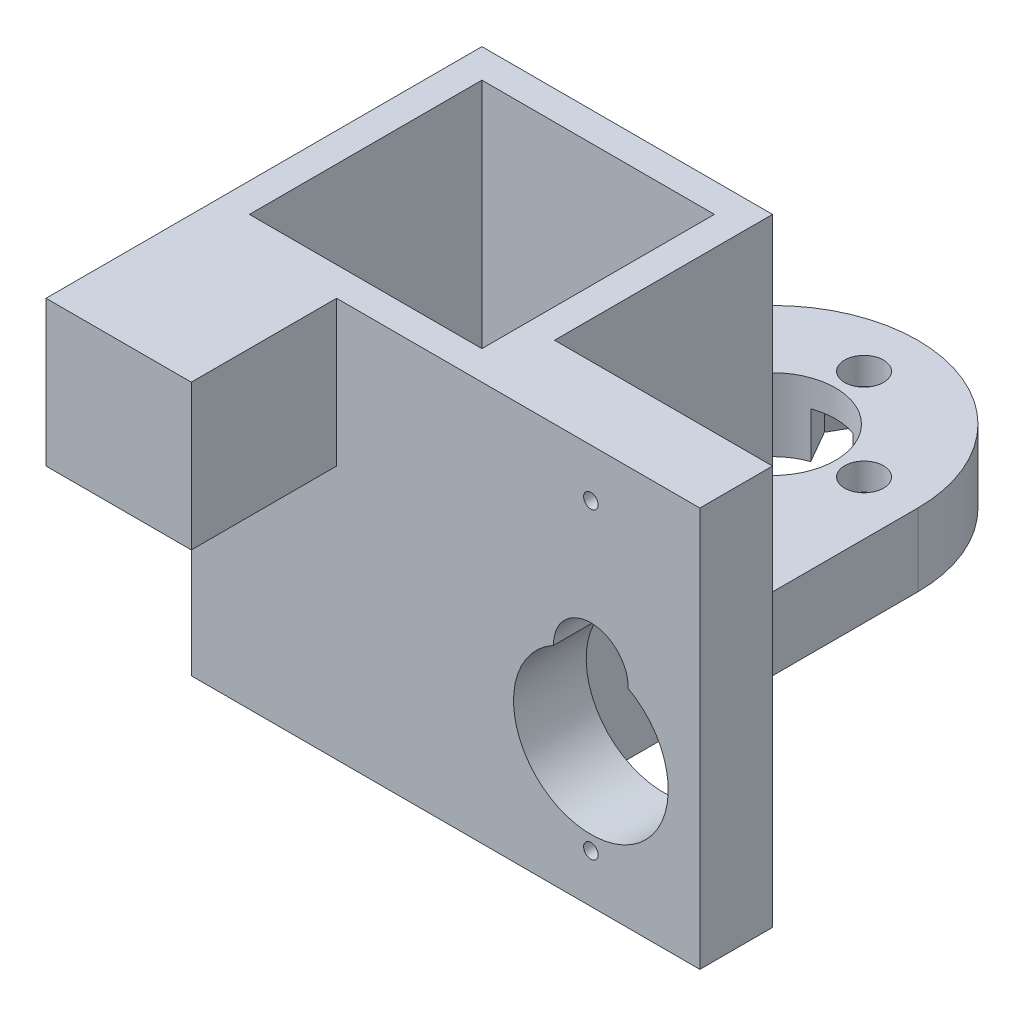
from build123d import *

# Parameters (mm, degrees)
SKETCH1_W            = 25.4
SKETCH1_H            = 25.4
SKETCH1_W_2          = 20.32
SKETCH1_H_2          = 20.32
BOSS_EXTRUDE1_DEPTH  = 17.4625
SKETCH4_W            = 25.4
SKETCH4_H            = 25.4
BOSS_EXTRUDE2_DEPTH  = 6.35
CUT_EXTRUDE1_REACH   = 51.289
SKETCH6_R            = 5.5
FILLET1_R            = 12.7
M3_CLEARANCE_HOLE1_D = 3.4
CIRPATTERN1_COUNT    = 4
CUT_EXTRUDE2_DEPTH   = 4
CIRPATTERN2_COUNT    = 4
SKETCH12_W           = 19.05
SKETCH12_H           = 34.925
BOSS_EXTRUDE3_DEPTH  = 6.35
SKETCH13_W           = 12.7
SKETCH13_H           = 12.7
BOSS_EXTRUDE4_DEPTH  = 12.7
CUT_EXTRUDE3_REACH   = 59.348
SKETCH15_R           = 0.635
CUT_EXTRUDE4_REACH   = 64.399


with BuildPart() as part:
    # Sketch1 → Boss-Extrude1 (new, symmetric)
    with BuildSketch(Plane(origin=(0, 0, 0), x_dir=(1, 0, 0), z_dir=(0, 1, 0))):
        Rectangle(SKETCH1_W, SKETCH1_H)
        Rectangle(SKETCH1_W_2, SKETCH1_H_2, mode=Mode.SUBTRACT)
    extrude(amount=BOSS_EXTRUDE1_DEPTH, both=True)

    # Sketch4 → Boss-Extrude2 (add)
    with BuildSketch(Plane.XZ.offset(17.4625)):
        with Locations((0, -25.4)):
            Rectangle(SKETCH4_W, SKETCH4_H)
    extrude(amount=-BOSS_EXTRUDE2_DEPTH)

    # Sketch6 → Cut-Extrude1 (cut, up to next)
    with BuildSketch(Plane(origin=(0, -11.1125, 0), x_dir=(1, 0, 0), z_dir=(0, 1, 0)), mode=Mode.PRIVATE) as cut_extrude1_sk1:
        with Locations(Location((0, 25.4, 0), (0, 0, 270))):
            Circle(SKETCH6_R)
    cut_extrude1_tool1 = extrude(cut_extrude1_sk1.sketch, amount=-CUT_EXTRUDE1_REACH, mode=Mode.PRIVATE) & part.part
    add(cut_extrude1_tool1.solids().sort_by_distance((0, -11.1125, -25.4))[0], mode=Mode.SUBTRACT)

    # Fillet1
    fillet1_edges = [part.edges().sort_by_distance(p)[0] for p in [
        (-12.7, -14.2875, -38.1),
        (12.7, -14.2875, -38.1),
    ]]
    fillet(fillet1_edges, radius=FILLET1_R - 0.0001)  # a hair under: the kernel refuses the full size

    # M3 Clearance Hole1 (through all)
    with Locations(Plane(origin=(0, -11.1125, 0), x_dir=(1, 0, 0), z_dir=(0, 1, 0))):
        with Locations((0, 33.4)):
            m3_clearance_hole1 = Hole(M3_CLEARANCE_HOLE1_D / 2)

    # CirPattern1: M3 Clearance Hole1 ×4 about axis
    cirpattern1_axis = Axis((0, 0, -25.4), (0, 1, 0))
    for i in range(1, CIRPATTERN1_COUNT):
        add(m3_clearance_hole1.rotate(cirpattern1_axis, i * 360 / CIRPATTERN1_COUNT), mode=Mode.SUBTRACT)

    # Sketch11 → Cut-Extrude2 (cut)
    with BuildSketch(Plane.XZ.offset(17.4625)):
        Polygon((1.732050808, -14.4), (-1.732050808, -14.4), (-3.464101615, -17.4), (-1.732050808, -20.4), (1.732050808, -20.4), (3.464101615, -17.4), align=None)
    cut_extrude2 = extrude(amount=-CUT_EXTRUDE2_DEPTH, mode=Mode.SUBTRACT)

    # CirPattern2: Cut-Extrude2 ×4 about axis
    cirpattern2_axis = Axis((0, 0, -25.4), (0, 1, 0))
    for i in range(1, CIRPATTERN2_COUNT):
        add(cut_extrude2.rotate(cirpattern2_axis, i * 360 / CIRPATTERN2_COUNT), mode=Mode.SUBTRACT)

    # Sketch12 → Boss-Extrude3 (add)
    with BuildSketch(Plane.XY.offset(12.7)):
        with Locations((22.225, 0)):
            Rectangle(SKETCH12_W, SKETCH12_H)
    extrude(amount=-BOSS_EXTRUDE3_DEPTH)

    # Sketch13 → Boss-Extrude4 (add)
    with BuildSketch(Plane.ZY.offset(12.7)):
        with Locations((19.05, 11.1125)):
            Rectangle(SKETCH13_W, SKETCH13_H)
    extrude(amount=-BOSS_EXTRUDE4_DEPTH)

    # Sketch15 → Cut-Extrude3 (cut, up to next)
    with BuildSketch(Plane(origin=(0, 0, 6.35), x_dir=(-1, 0, 0), z_dir=(0, 0, -1)), mode=Mode.PRIVATE) as cut_extrude3_sk1:
        with Locations((-22.225, 13.25)):
            Circle(SKETCH15_R)
    cut_extrude3_tool1 = extrude(cut_extrude3_sk1.sketch, amount=-CUT_EXTRUDE3_REACH, mode=Mode.PRIVATE) & part.part
    # Sketch15 → Cut-Extrude3 (cut, up to next)
    with BuildSketch(Plane(origin=(0, 0, 6.35), x_dir=(-1, 0, 0), z_dir=(0, 0, -1)), mode=Mode.PRIVATE) as cut_extrude3_sk2:
        with Locations((-22.225, -13.25)):
            Circle(SKETCH15_R)
    cut_extrude3_tool2 = extrude(cut_extrude3_sk2.sketch, amount=-CUT_EXTRUDE3_REACH, mode=Mode.PRIVATE) & part.part
    add(cut_extrude3_tool1.solids().sort_by_distance((22.225, 13.25, 6.35))[0], mode=Mode.SUBTRACT)
    add(cut_extrude3_tool2.solids().sort_by_distance((22.225, -13.25, 6.35))[0], mode=Mode.SUBTRACT)

    # Sketch16 → Cut-Extrude4 (cut, up to next)
    with BuildSketch(Plane.XY.offset(12.7), mode=Mode.PRIVATE) as cut_extrude4_sk1:
        with BuildLine():
            ThreePointArc((18.963893252, 0.673666667), (22.225, -12.012), (25.486106748, 0.673666667))
            ThreePointArc((25.486106748, 0.673666667), (22.225, 4.012), (18.963893252, 0.673666667))
        make_face()
    cut_extrude4_tool1 = extrude(cut_extrude4_sk1.sketch, amount=-CUT_EXTRUDE4_REACH, mode=Mode.PRIVATE) & part.part
    add(cut_extrude4_tool1.solids().sort_by_distance((22.225, -4.592909, 12.7))[0], mode=Mode.SUBTRACT)


solid = part.part
